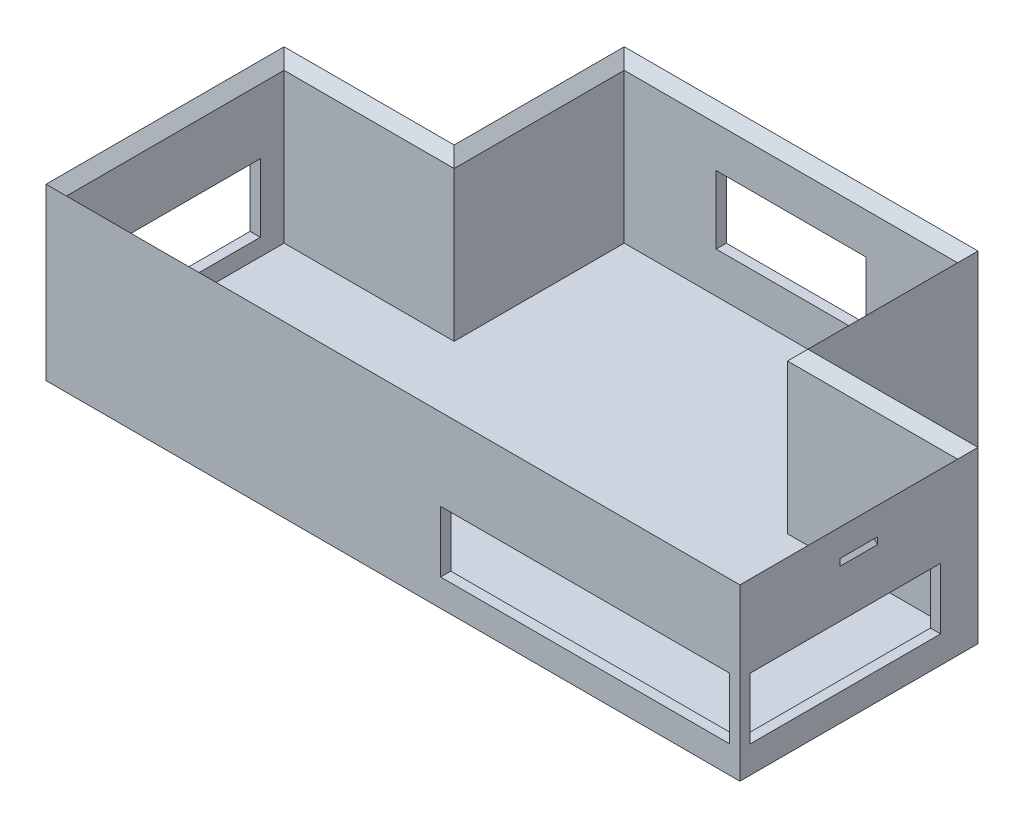
from build123d import *

# Parameters (mm, degrees)
BOSS_EXTRUDE1_DEPTH = 50
CUT_EXTRUDE1_DEPTH  = 47
CHAMFER3_SIZE       = 3
SKETCH5_W           = 56
SKETCH5_H           = 18
CUT_EXTRUDE2_DEPTH  = 3
SKETCH6_W           = 85
SKETCH6_H           = 18
CUT_EXTRUDE3_DEPTH  = 3
SKETCH7_W           = 50
SKETCH7_H           = 20
CUT_EXTRUDE4_DEPTH  = 3
SKETCH8_W           = 44
SKETCH8_H           = 20
CUT_EXTRUDE5_DEPTH  = 3
SKETCH9_W           = 11
SKETCH9_H           = 2
CUT_EXTRUDE6_DEPTH  = 1
DRAFT3_START        = -46.843617021
DRAFT3_DEPTH        = 11
SKETCH12_W          = 11
SKETCH12_H          = 2
CUT_EXTRUDE7_DEPTH  = 1
DRAFT4_START        = -46.843617021
DRAFT4_DEPTH        = 11


# Read off the part's stored shape, not the designer's step: Draft3, Draft4
with BuildPart() as part:
    # Sketch1 → Boss-Extrude1 (new body)
    with BuildSketch(Plane(origin=(0, 0, 0), x_dir=(1, 0, 0), z_dir=(0, 1, 0))):
        Polygon((-88.764893617, 6.343617021), (115.235106383, 6.343617021), (115.235106383, 76.343617021), (65.235106383, 76.343617021), (65.235106383, 126.343617021), (-38.764893617, 126.343617021), (-38.764893617, 76.343617021), (-88.764893617, 76.343617021), align=None)
    extrude(amount=BOSS_EXTRUDE1_DEPTH)

    # Sketch4 → Cut-Extrude1 (cut)
    with BuildSketch(Plane(origin=(0, 50, 0), x_dir=(1, 0, 0), z_dir=(0, 1, 0))):
        Polygon((-35.764893617, 123.343617021), (-35.764893617, 73.343617021), (-85.764893617, 73.343617021), (-85.764893617, 9.343617021), (112.235106383, 9.343617021), (112.235106383, 73.343617021), (62.235106383, 73.343617021), (62.235106383, 123.343617021), align=None)
    extrude(amount=-CUT_EXTRUDE1_DEPTH, mode=Mode.SUBTRACT)

    # Chamfer3
    chamfer3_edges = [part.edges().sort_by_distance(p)[0] for p in [
        (13.235106383, 50, -123.343617021),
        (-35.764893617, 50, -98.343617021),
        (-60.764893617, 50, -73.343617021),
        (-85.764893617, 50, -41.343617021),
        (13.235106383, 50, -9.343617021),
        (112.235106383, 50, -41.343617021),
        (87.235106383, 50, -73.343617021),
        (62.235106383, 50, -98.343617021),
    ]]
    chamfer(chamfer3_edges, length=CHAMFER3_SIZE - 0.0001)  # a hair under: the kernel refuses the full size

    # Sketch5 → Cut-Extrude2 (cut)
    with BuildSketch(Plane(origin=(115.235106383, 0, 0), x_dir=(0, 0, -1), z_dir=(1, 0, 0))):
        with Locations((37.343617021, 17)):
            Rectangle(SKETCH5_W, SKETCH5_H)
    extrude(amount=-CUT_EXTRUDE2_DEPTH, mode=Mode.SUBTRACT)

    # Sketch6 → Cut-Extrude3 (cut)
    with BuildSketch(Plane.XY.offset(-6.343617021)):
        with Locations((69.735106383, 17)):
            Rectangle(SKETCH6_W, SKETCH6_H)
    extrude(amount=-CUT_EXTRUDE3_DEPTH, mode=Mode.SUBTRACT)

    # Sketch7 → Cut-Extrude4 (cut)
    with BuildSketch(Plane.ZY.offset(88.764893617)):
        with Locations((-41.343617021, 18)):
            Rectangle(SKETCH7_W, SKETCH7_H)
    extrude(amount=-CUT_EXTRUDE4_DEPTH, mode=Mode.SUBTRACT)

    # Sketch8 → Cut-Extrude5 (cut)
    with BuildSketch(Plane(origin=(0, 0, -126.343617021), x_dir=(-1, 0, 0), z_dir=(0, 0, -1))):
        with Locations((-13.235106383, 25)):
            Rectangle(SKETCH8_W, SKETCH8_H)
    extrude(amount=-CUT_EXTRUDE5_DEPTH, mode=Mode.SUBTRACT)

    # Sketch9 → Cut-Extrude6 (cut)
    with BuildSketch(Plane(origin=(115.235106383, 0, 0), x_dir=(0, 0, -1), z_dir=(1, 0, 0))):
        with Locations((41.343617021, 41)):
            Rectangle(SKETCH9_W, SKETCH9_H)
    extrude(amount=-CUT_EXTRUDE6_DEPTH, mode=Mode.SUBTRACT)

    # Draft3 outline → Draft3 (add)
    with BuildSketch(Plane.XY.offset(DRAFT3_START)):
        Polygon((114.235106383, 42), (114.235106383, 41), (115.235106383, 42), align=None)
        Polygon((115.235106383, 40), (114.235106383, 41), (114.235106383, 40), align=None)
    extrude(amount=DRAFT3_DEPTH)

    # Sketch12 → Cut-Extrude7 (cut)
    with BuildSketch(Plane.ZY.offset(88.764893617)):
        with Locations((-41.343617021, 41)):
            Rectangle(SKETCH12_W, SKETCH12_H)
    extrude(amount=-CUT_EXTRUDE7_DEPTH, mode=Mode.SUBTRACT)

    # Draft4 outline → Draft4 (add)
    with BuildSketch(Plane.XY.offset(DRAFT4_START)):
        Polygon((-87.764893617, 42), (-88.764893617, 42), (-87.764893617, 41), align=None)
        Polygon((-87.764893617, 40), (-87.764893617, 41), (-88.764893617, 40), align=None)
    extrude(amount=DRAFT4_DEPTH)


solid = part.part
